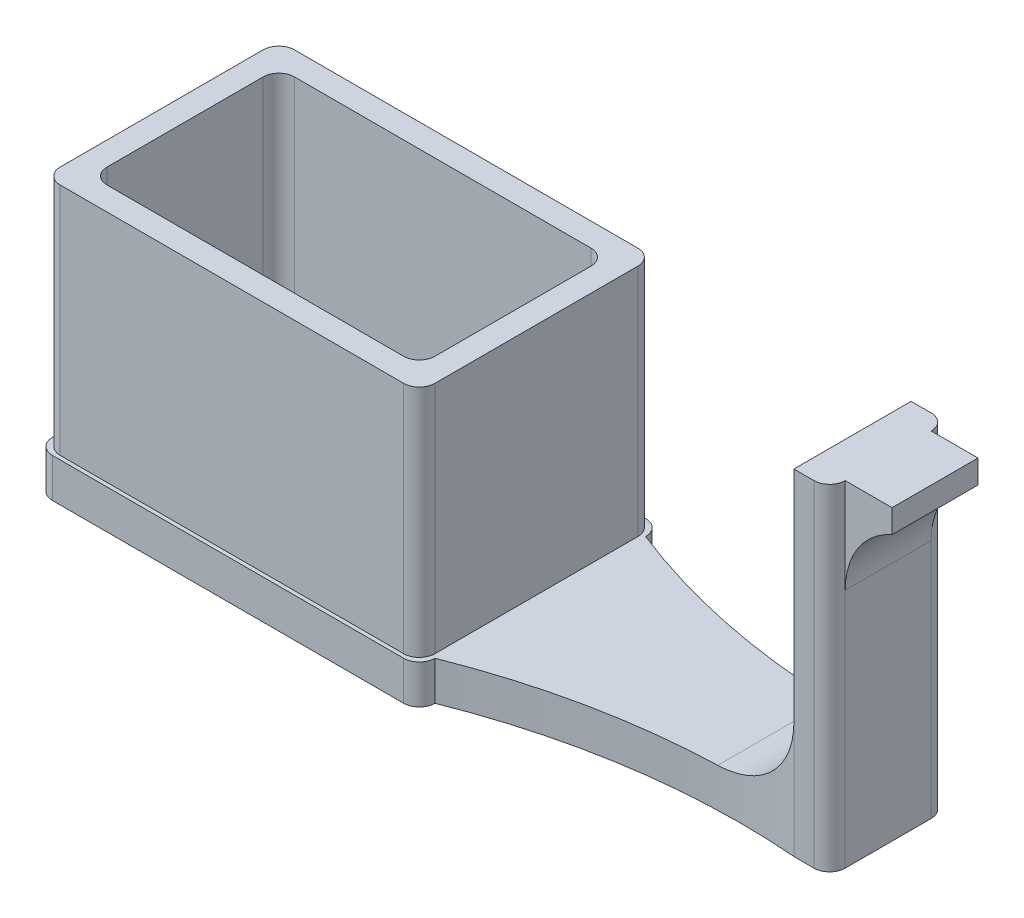
from build123d import *

# Parameters (mm, degrees)
SALIENTE_EXTRUIR2_DEPTH      = 30
SALIENTE_EXTRUIR3_DEPTH      = 5
SALIENTE_EXTRUIR6_DEPTH      = 5
SALIENTE_EXTRUIR7_DEPTH      = 38
SALIENTE_EXTRUIR7_DEPTH_BACK = 5
CROQUIS6_W                   = 11.011799298781469
CROQUIS6_H                   = 3.000000000000007
SALIENTE_EXTRUIR8_DEPTH      = 6
REDONDEO1_R                  = 10
REDONDEO2_R                  = 10


with BuildPart() as part:
    # Croquis1 → Saliente-Extruir2 (new body)
    with BuildSketch(Plane(origin=(0, 0, 0), x_dir=(1, 0, 0), z_dir=(0, 1, 0))):
        with BuildLine():
            Line((-22.000000000000007, 14.99999999999999), (21.999999999999964, 14.999999999999993))
            ThreePointArc((21.999999999999964, 14.999999999999993), (23.414213562373074, 14.414213562373087), (23.99999999999998, 12.999999999999977))
            Line((23.99999999999998, 12.999999999999977), (23.999999999999975, -12.999999999999996))
            ThreePointArc((23.999999999999975, -12.999999999999996), (23.41421356237307, -14.414213562373105), (21.99999999999996, -15.00000000000001))
            Line((21.99999999999996, -15.00000000000001), (-22.000000000000007, -15.000000000000007))
            ThreePointArc((-22.000000000000007, -15.000000000000007), (-23.414213562373117, -14.414213562373103), (-24.00000000000002, -12.999999999999993))
            Line((-24.00000000000002, -12.999999999999993), (-24.00000000000002, 12.999999999999975))
            ThreePointArc((-24.00000000000002, 12.999999999999975), (-23.414213562373117, 14.414213562373085), (-22.000000000000007, 14.99999999999999))
        make_face()
        with BuildLine():
            Line((-19.00000000000001, -12.00000000000001), (18.999999999999964, -12.00000000000001))
            ThreePointArc((18.999999999999964, -12.00000000000001), (20.414213562373074, -11.414213562373106), (20.999999999999982, -9.999999999999996))
            Line((20.999999999999982, -9.999999999999996), (20.999999999999982, 9.999999999999975))
            ThreePointArc((20.999999999999982, 9.999999999999975), (20.414213562373078, 11.414213562373085), (18.999999999999968, 11.99999999999999))
            Line((18.999999999999968, 11.99999999999999), (-19.000000000000007, 11.99999999999999))
            ThreePointArc((-19.000000000000007, 11.99999999999999), (-20.414213562373117, 11.414213562373083), (-21.00000000000002, 9.999999999999975))
            Line((-21.00000000000002, 9.999999999999975), (-21.00000000000002, -9.999999999999996))
            ThreePointArc((-21.00000000000002, -9.999999999999996), (-20.41421356237312, -11.414213562373106), (-19.00000000000001, -12.00000000000001))
        make_face(mode=Mode.SUBTRACT)
    extrude(amount=SALIENTE_EXTRUIR2_DEPTH)

    # Croquis3 → Saliente-Extruir3 (add)
    with BuildSketch(Plane(origin=(0, 0, 0), x_dir=(1, 0, 0), z_dir=(0, 1, 0))):
        with BuildLine():
            Line((-22.5, -15.500000000000004), (22.500000000000004, -15.500000000000004))
            ThreePointArc((22.500000000000004, -15.500000000000004), (23.9142135623731, -14.9142135623731), (24.500000000000007, -13.500000000000004))
            Line((24.500000000000007, -13.500000000000004), (24.500000000000007, 13.499999999999996))
            ThreePointArc((24.500000000000007, 13.499999999999996), (23.9142135623731, 14.914213562373092), (22.500000000000004, 15.499999999999996))
            Line((22.500000000000004, 15.499999999999996), (-22.5, 15.499999999999996))
            ThreePointArc((-22.5, 15.499999999999996), (-23.914213562373096, 14.914213562373092), (-24.5, 13.499999999999996))
            Line((-24.5, 13.499999999999996), (-24.5, -13.500000000000004))
            ThreePointArc((-24.5, -13.500000000000004), (-23.914213562373096, -14.9142135623731), (-22.5, -15.500000000000004))
        make_face()
        with BuildLine():
            Line((-19.05524973121013, -11.999999999999982), (19.055249731210118, -11.999999999999982))
            ThreePointArc((19.055249731210118, -11.999999999999982), (20.469463293583225, -11.414213562373076), (21.055249731210132, -9.99999999999997))
            Line((21.055249731210132, -9.99999999999997), (21.055249731210132, 9.999999999999975))
            ThreePointArc((21.055249731210132, 9.999999999999975), (20.469463293583225, 11.414213562373083), (19.055249731210118, 11.99999999999999))
            Line((19.055249731210118, 11.99999999999999), (-19.05524973121013, 11.99999999999999))
            ThreePointArc((-19.05524973121013, 11.99999999999999), (-20.469463293583242, 11.414213562373087), (-21.055249731210147, 9.999999999999975))
            Line((-21.055249731210147, 9.999999999999975), (-21.055249731210147, -9.99999999999997))
            ThreePointArc((-21.055249731210147, -9.99999999999997), (-20.46946329358324, -11.414213562373078), (-19.05524973121013, -11.999999999999982))
        make_face(mode=Mode.SUBTRACT)
    extrude(amount=-SALIENTE_EXTRUIR3_DEPTH)

    # Croquis4 → Saliente-Extruir6 (add)
    with BuildSketch(Plane(origin=(0, 0, 0), x_dir=(1, 0, 0), z_dir=(0, 1, 0))):
        with BuildLine():
            Line((24.500000000000007, 13.499999999999996), (24.500000000000004, -13.500000000000004))
            ThreePointArc((24.500000000000004, -13.500000000000004), (44.15530933646711, -8.202062243114), (64.5, -7.5))
            Line((64.5, -7.5), (64.5, 7.5))
            ThreePointArc((64.5, 7.5), (44.15530933646711, 8.202062243114), (24.500000000000007, 13.499999999999996))
        make_face()
    extrude(amount=-SALIENTE_EXTRUIR6_DEPTH)

    # Croquis5 → Saliente-Extruir7 (add, two sides: drawn at the far end of the back side and taken through both)
    with BuildSketch(Plane(origin=(0, 0, 0), x_dir=(1, 0, 0), z_dir=(0, 1, 0)).offset(-SALIENTE_EXTRUIR7_DEPTH_BACK)):
        with BuildLine():
            Line((64.5, 7.5), (67.07409002976354, 7.5))
            ThreePointArc((67.07409002976354, 7.5), (68.48830359213665, 6.914213562373095), (69.07409002976355, 5.499999999999986))
            Line((69.07409002976355, 5.499999999999986), (69.07409002976355, -5.511799298781482))
            ThreePointArc((69.07409002976355, -5.511799298781482), (68.48830359213665, -6.926012861154591), (67.07409002976354, -7.511799298781496))
            Line((67.07409002976354, -7.511799298781496), (64.5, -7.511799298781496))
            Line((64.5, -7.511799298781496), (64.5, 7.5))
        make_face()
    extrude(amount=SALIENTE_EXTRUIR7_DEPTH + SALIENTE_EXTRUIR7_DEPTH_BACK)

    # Croquis6 → Saliente-Extruir8 (add)
    with BuildSketch(Plane(origin=(69.07409002976355, 0, 0), x_dir=(0, 0, -1), z_dir=(1, 0, 0))):
        with Locations((-0.00589964939074816, 36.5)):
            Rectangle(CROQUIS6_W, CROQUIS6_H)
    extrude(amount=SALIENTE_EXTRUIR8_DEPTH)

    # Redondeo1
    # the kernel refuses this fillet: 10 mm, written as the material it adds along each edge
    with BuildSketch(Plane(origin=(69.07409002976355, 34.99999999999999, -5.499999999999986), x_dir=(0, -1, 0), z_dir=(0, 0, 1))) as redondeo1_piece_1:
        with BuildLine():
            CenterArc((9.165151389911681, 10), REDONDEO1_R, 203.57817847820183, 66.42182152179817)
            Line((0, 6), (-0.1833030277982317, 5.920000000000002))
            ThreePointArc((-0.1833030277982317, 5.920000000000002), (-0.20000000000000284, 3), (-0.20000000000000284, 0))
            Line((-0.20000000000000284, 0), (0, -0.20000000000000284))
            Line((0, -0.20000000000000284), (9.165151389911681, -0.20000000000000284))
            Line((9.165151389911681, -0.20000000000000284), (9.165151389911681, 0))
        make_face()
    extrude(amount=11.011799298781469)

    # Redondeo2
    # the kernel refuses this fillet: 10 mm, written as the material it adds along each edge
    with BuildSketch(Plane(origin=(64.5, 0, 32.5), x_dir=(0, 1, 0), z_dir=(0, 0, -1))) as redondeo2_piece_1_section:
        with BuildLine():
            CenterArc((REDONDEO2_R, -REDONDEO2_R), REDONDEO2_R, 90, 90)
            Line((-1.78e-15, -REDONDEO2_R), (0, 0))
            Line((0, 0), (REDONDEO2_R, 0))
        make_face()
    redondeo2_piece_1 = extrude(amount=40, mode=Mode.PRIVATE)
    redondeo2_piece_1 = redondeo2_piece_1 - Plane(origin=(57.38283856523079, 2.2812859776198304, 96.38559043487189), x_dir=(-0.3687654044862285, 0, -0.9295224991650866), z_dir=(0, 1, 0)) * Cylinder(89.17007442995858, 120, mode=Mode.PRIVATE)
    redondeo2_piece_1 = redondeo2_piece_1 - Plane(origin=(57.38283856523077, 2.2812859776198304, -96.38559043487177), x_dir=(0.07981558252886325, 0, 0.9968096472173502), z_dir=(0, 1, 0)) * Cylinder(89.17007442995846, 120, mode=Mode.PRIVATE)
    add(redondeo2_piece_1)


solid = part.part
